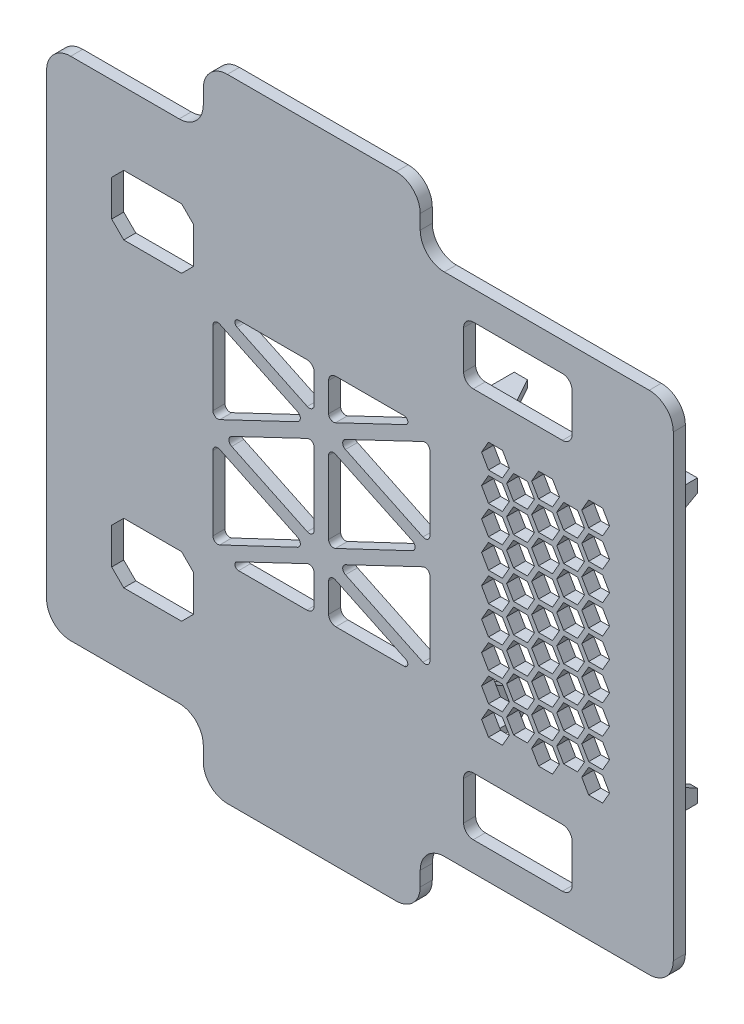
from build123d import *

# Parameters (mm, degrees)
EXTRUDE_1_DEPTH       = 5
EXTRUDE_2_DEPTH       = 20
CUT_EXTRUDE_3_DEPTH   = 10
CUT_EXTRUDE_4_DEPTH   = 10
MIRROR_2_COPY_1_DEPTH = 20
MIRROR_2_COPY_2_DEPTH = 10
MIRROR_2_COPY_3_DEPTH = 10
MIRROR_2_COPY_4_DEPTH = 20
MIRROR_2_COPY_5_DEPTH = 10
MIRROR_2_COPY_6_DEPTH = 10
CUT_EXTRUDE_5_DEPTH   = 5
SKETCH_9_W            = 45
SKETCH_9_H            = 24
CUT_EXTRUDE_6_DEPTH   = 5
FILLET_1_R            = 4
FILLET_2_R            = 1.5
FILLET_3_R            = 2
FILLET_4_R            = 3
CUT_EXTRUDE_8_DEPTH   = 186.636742053


with BuildPart() as part:
    # 草图1 → 凸台-拉伸1 (new body)
    with BuildSketch(Plane.XY):
        with BuildLine():
            Line((-130, 95), (-130, -95))
            ThreePointArc((-130, -95), (-127.071067812, -102.071067812), (-120, -105))
            Line((-120, -105), (-75, -105))
            ThreePointArc((-75, -105), (-67.928932188, -107.928932188), (-65, -115))
            Line((-65, -115), (-65, -121))
            ThreePointArc((-65, -121), (-62.071067812, -128.071067812), (-55, -131))
            Line((-55, -131), (15, -131))
            ThreePointArc((15, -131), (22.071067812, -128.071067812), (25, -121))
            Line((25, -121), (25, -115))
            ThreePointArc((25, -115), (27.928932188, -107.928932188), (35, -105))
            Line((35, -105), (120, -105))
            ThreePointArc((120, -105), (127.071067812, -102.071067812), (130, -95))
            Line((130, -95), (130, 95))
            ThreePointArc((130, 95), (127.071067812, 102.071067812), (120, 105))
            Line((120, 105), (35, 105))
            ThreePointArc((35, 105), (27.928932188, 107.928932188), (25, 115))
            Line((25, 115), (25, 121))
            ThreePointArc((25, 121), (22.071067812, 128.071067812), (15, 131))
            Line((15, 131), (-55, 131))
            ThreePointArc((-55, 131), (-62.071067812, 128.071067812), (-65, 121))
            Line((-65, 121), (-65, 115))
            ThreePointArc((-65, 115), (-67.928932188, 107.928932188), (-75, 105))
            Line((-75, 105), (-120, 105))
            ThreePointArc((-120, 105), (-127.071067812, 102.071067812), (-130, 95))
        make_face()
    extrude(amount=EXTRUDE_1_DEPTH)

    # 草图4 → 凸台-拉伸2 (add)
    with BuildSketch(Plane(origin=(0, 0, 0), x_dir=(-1, 0, 0), z_dir=(0, 0, -1))):
        Polygon((-39, -47.5), (-39, -58.5), (-50, -58.5), (-50, -55.5), (-42, -55.5), (-42, -47.5), align=None)
    extrude_2 = extrude(amount=EXTRUDE_2_DEPTH)

    # 草图5 → 切除-拉伸3 (cut)
    with BuildSketch(Plane.XZ.offset(58.5)):
        Polygon((50, -10), (44.5, -20), (50, -20), align=None)
    cut_extrude_3 = extrude(amount=-CUT_EXTRUDE_3_DEPTH, mode=Mode.SUBTRACT)

    # 草图6 → 切除-拉伸4 (cut)
    with BuildSketch(Plane.ZY.offset(-39)):
        Polygon((-20, -53), (-10, -47.5), (-20, -47.5), align=None)
    cut_extrude_4 = extrude(amount=-CUT_EXTRUDE_4_DEPTH, mode=Mode.SUBTRACT)

    # 镜向1: 凸台-拉伸2, 切除-拉伸3, 切除-拉伸4 across plane
    add(extrude_2.mirror(Plane(origin=(77, 0, 0), x_dir=(0, 0, 1), z_dir=(1, 0, 0))))
    add(cut_extrude_3.mirror(Plane(origin=(77, 0, 0), x_dir=(0, 0, 1), z_dir=(1, 0, 0))), mode=Mode.SUBTRACT)
    add(cut_extrude_4.mirror(Plane(origin=(77, 0, 0), x_dir=(0, 0, 1), z_dir=(1, 0, 0))), mode=Mode.SUBTRACT)

    # 镜向2 copy 1 sketch → 镜向2 copy 1 (add)
    with BuildSketch(Plane(origin=(154, 0, 0), x_dir=(1, 0, 0), z_dir=(0, 0, -1))):
        Polygon((-39, -47.5), (-39, -58.5), (-50, -58.5), (-50, -55.5), (-42, -55.5), (-42, -47.5), align=None)
    extrude(amount=MIRROR_2_COPY_1_DEPTH)

    # 镜向2 copy 2 sketch → 镜向2 copy 2 (cut)
    with BuildSketch(Plane(origin=(154, 58.5, 0), x_dir=(-1, 0, 0), z_dir=(0, 1, 0))):
        Polygon((50, -10), (44.5, -20), (50, -20), align=None)
    extrude(amount=-MIRROR_2_COPY_2_DEPTH, mode=Mode.SUBTRACT)

    # 镜向2 copy 3 sketch → 镜向2 copy 3 (cut)
    with BuildSketch(Plane(origin=(115, 0, 0), x_dir=(0, 0, 1), z_dir=(1, 0, 0))):
        Polygon((-20, -53), (-10, -47.5), (-20, -47.5), align=None)
    extrude(amount=-MIRROR_2_COPY_3_DEPTH, mode=Mode.SUBTRACT)

    # 镜向2 copy 4 sketch → 镜向2 copy 4 (add)
    with BuildSketch(Plane(origin=(0, 0, 0), x_dir=(-1, 0, 0), z_dir=(0, 0, -1))):
        Polygon((-39, 47.5), (-39, 58.5), (-50, 58.5), (-50, 55.5), (-42, 55.5), (-42, 47.5), align=None)
    extrude(amount=MIRROR_2_COPY_4_DEPTH)

    # 镜向2 copy 5 sketch → 镜向2 copy 5 (cut)
    with BuildSketch(Plane(origin=(0, 58.5, 0), x_dir=(1, 0, 0), z_dir=(0, 1, 0))):
        Polygon((50, 10), (44.5, 20), (50, 20), align=None)
    extrude(amount=-MIRROR_2_COPY_5_DEPTH, mode=Mode.SUBTRACT)

    # 镜向2 copy 6 sketch → 镜向2 copy 6 (cut)
    with BuildSketch(Plane.ZY.offset(-39)):
        Polygon((-20, 53), (-10, 47.5), (-20, 47.5), align=None)
    extrude(amount=-MIRROR_2_COPY_6_DEPTH, mode=Mode.SUBTRACT)

    # 草图7 → 切除-拉伸5 (cut)
    with BuildSketch(Plane(origin=(0, 0, 0), x_dir=(-1, 0, 0), z_dir=(0, 0, -1))):
        Polygon((-92.012994616, 36), (-94.899745962, 41), (-100.673248654, 41), (-103.56, 36), (-100.673248654, 31), (-94.899745962, 31), align=None)
        Polygon((-74.115136271, 31), (-71.228384925, 36), (-74.115136271, 41), (-79.888638963, 41), (-82.775390309, 36), (-79.888638963, 31), align=None)
        Polygon((-92.012994616, 24), (-94.899745962, 29), (-100.673248654, 29), (-103.56, 24), (-100.673248654, 19), (-94.899745962, 19), align=None)
        Polygon((-93.167695155, 30), (-90.280943809, 25), (-84.507441117, 25), (-81.620689771, 30), (-84.507441117, 35), (-90.280943809, 35), align=None)
        Polygon((-84.507441117, 37), (-81.620689771, 42), (-84.507441117, 47), (-90.280943809, 47), (-93.167695155, 42), (-90.280943809, 37), align=None)
        Polygon((-79.888638963, 43), (-74.115136271, 43), (-71.228384925, 48), (-74.115136271, 53), (-79.888638963, 53), (-82.775390309, 48), align=None)
        Polygon((-94.899745962, 43), (-92.012994616, 48), (-94.899745962, 53), (-100.673248654, 53), (-103.56, 48), (-100.673248654, 43), align=None)
        Polygon((-72.383085464, 42), (-69.496334118, 37), (-63.722831426, 37), (-60.83608008, 42), (-63.722831426, 47), (-69.496334118, 47), align=None)
        Polygon((-93.167695155, 18), (-90.280943809, 13), (-84.507441117, 13), (-81.620689771, 18), (-84.507441117, 23), (-90.280943809, 23), align=None)
        Polygon((-74.115136271, 19), (-71.228384925, 24), (-74.115136271, 29), (-79.888638963, 29), (-82.775390309, 24), (-79.888638963, 19), align=None)
        Polygon((-72.383085464, 30), (-69.496334118, 25), (-63.722831426, 25), (-60.83608008, 30), (-63.722831426, 35), (-69.496334118, 35), align=None)
        Polygon((-92.012994616, 12), (-94.899745962, 17), (-100.673248654, 17), (-103.56, 12), (-100.673248654, 7), (-94.899745962, 7), align=None)
        Polygon((-93.167695155, 6), (-90.280943809, 1), (-84.507441117, 1), (-81.620689771, 6), (-84.507441117, 11), (-90.280943809, 11), align=None)
        Polygon((-74.115136271, 7), (-71.228384925, 12), (-74.115136271, 17), (-79.888638963, 17), (-82.775390309, 12), (-79.888638963, 7), align=None)
        Polygon((-72.383085464, 18), (-69.496334118, 13), (-63.722831426, 13), (-60.83608008, 18), (-63.722831426, 23), (-69.496334118, 23), align=None)
        Polygon((-92.012994616, 0), (-94.899745962, 5), (-100.673248654, 5), (-103.56, 0), (-100.673248654, -5), (-94.899745962, -5), align=None)
        Polygon((-93.167695155, -6), (-90.280943809, -11), (-84.507441117, -11), (-81.620689771, -6), (-84.507441117, -1), (-90.280943809, -1), align=None)
        Polygon((-74.115136271, -5), (-71.228384925, 0), (-74.115136271, 5), (-79.888638963, 5), (-82.775390309, 0), (-79.888638963, -5), align=None)
        Polygon((-72.383085464, 6), (-69.496334118, 1), (-63.722831426, 1), (-60.83608008, 6), (-63.722831426, 11), (-69.496334118, 11), align=None)
        Polygon((-92.012994616, -12), (-94.899745962, -7), (-100.673248654, -7), (-103.56, -12), (-100.673248654, -17), (-94.899745962, -17), align=None)
        Polygon((-93.167695155, -18), (-90.280943809, -23), (-84.507441117, -23), (-81.620689771, -18), (-84.507441117, -13), (-90.280943809, -13), align=None)
        Polygon((-74.115136271, -17), (-71.228384925, -12), (-74.115136271, -7), (-79.888638963, -7), (-82.775390309, -12), (-79.888638963, -17), align=None)
        Polygon((-72.383085464, -6), (-69.496334118, -11), (-63.722831426, -11), (-60.83608008, -6), (-63.722831426, -1), (-69.496334118, -1), align=None)
        Polygon((-92.012994616, -24), (-94.899745962, -19), (-100.673248654, -19), (-103.56, -24), (-100.673248654, -29), (-94.899745962, -29), align=None)
        Polygon((-93.167695155, -30), (-90.280943809, -35), (-84.507441117, -35), (-81.620689771, -30), (-84.507441117, -25), (-90.280943809, -25), align=None)
        Polygon((-74.115136271, -29), (-71.228384925, -24), (-74.115136271, -19), (-79.888638963, -19), (-82.775390309, -24), (-79.888638963, -29), align=None)
        Polygon((-72.383085464, -18), (-69.496334118, -23), (-63.722831426, -23), (-60.83608008, -18), (-63.722831426, -13), (-69.496334118, -13), align=None)
        Polygon((-92.012994616, -36), (-94.899745962, -31), (-100.673248654, -31), (-103.56, -36), (-100.673248654, -41), (-94.899745962, -41), align=None)
        Polygon((-93.167695155, -42), (-90.280943809, -47), (-84.507441117, -47), (-81.620689771, -42), (-84.507441117, -37), (-90.280943809, -37), align=None)
        Polygon((-74.115136271, -41), (-71.228384925, -36), (-74.115136271, -31), (-79.888638963, -31), (-82.775390309, -36), (-79.888638963, -41), align=None)
        Polygon((-72.383085464, -30), (-69.496334118, -35), (-63.722831426, -35), (-60.83608008, -30), (-63.722831426, -25), (-69.496334118, -25), align=None)
        Polygon((-92.012994616, -48), (-94.899745962, -43), (-100.673248654, -43), (-103.56, -48), (-100.673248654, -53), (-94.899745962, -53), align=None)
        Polygon((-74.115136271, -53), (-71.228384925, -48), (-74.115136271, -43), (-79.888638963, -43), (-82.775390309, -48), (-79.888638963, -53), align=None)
        Polygon((-72.383085464, -42), (-69.496334118, -47), (-63.722831426, -47), (-60.83608008, -42), (-63.722831426, -37), (-69.496334118, -37), align=None)
        Polygon((-61.990780618, 36), (-59.104029272, 31), (-53.330526581, 31), (-50.443775235, 36), (-53.330526581, 41), (-59.104029272, 41), align=None)
        Polygon((-61.990780618, 48), (-59.104029272, 43), (-53.330526581, 43), (-50.443775235, 48), (-53.330526581, 53), (-59.104029272, 53), align=None)
        Polygon((-61.990780618, 24), (-59.104029272, 19), (-53.330526581, 19), (-50.443775235, 24), (-53.330526581, 29), (-59.104029272, 29), align=None)
        Polygon((-61.990780618, 12), (-59.104029272, 7), (-53.330526581, 7), (-50.443775235, 12), (-53.330526581, 17), (-59.104029272, 17), align=None)
        Polygon((-61.990780618, 0), (-59.104029272, -5), (-53.330526581, -5), (-50.443775235, 0), (-53.330526581, 5), (-59.104029272, 5), align=None)
        Polygon((-61.990780618, -12), (-59.104029272, -17), (-53.330526581, -17), (-50.443775235, -12), (-53.330526581, -7), (-59.104029272, -7), align=None)
        Polygon((-61.990780618, -24), (-59.104029272, -29), (-53.330526581, -29), (-50.443775235, -24), (-53.330526581, -19), (-59.104029272, -19), align=None)
        Polygon((-61.990780618, -36), (-59.104029272, -41), (-53.330526581, -41), (-50.443775235, -36), (-53.330526581, -31), (-59.104029272, -31), align=None)
        Polygon((-61.990780618, -48), (-59.104029272, -53), (-53.330526581, -53), (-50.443775235, -48), (-53.330526581, -43), (-59.104029272, -43), align=None)
    extrude(amount=-CUT_EXTRUDE_5_DEPTH, mode=Mode.SUBTRACT)

    # 草图9 → 切除-拉伸6 (cut)
    with BuildSketch(Plane(origin=(0, 0, 0), x_dir=(-1, 0, 0), z_dir=(0, 0, -1))):
        Polygon((9.804878049, 22.5), (-29, 41), (-29, 4), align=None)
        Polygon((13, -26.88372093), (-25, -45), (13, -45), align=None)
        Polygon((22.074593576, -22.557461202), (61, -41), (61, -4), align=None)
        Polygon((19, 26.88372093), (57, 45), (19, 45), align=None)
        Polygon((19, -18.11627907), (57, 0), (19, 18.11627907), align=None)
        with Locations((-65.5, 81)):
            Rectangle(SKETCH_9_W, SKETCH_9_H)
        with Locations((-65.5, -81)):
            Rectangle(SKETCH_9_W, SKETCH_9_H)
        Polygon((13, 45), (-25, 45), (13, 26.88372093), align=None)
        Polygon((61, 4), (61, 41), (22.074593576, 22.557461202), align=None)
        Polygon((13, 18.257993079), (-25.535898385, 0), (13, -18.257993079), align=None)
        Polygon((19, -45), (57, -45), (19, -26.88372093), align=None)
        Polygon((-29, -41), (9.804878049, -22.5), (-29, -4), align=None)
    extrude(amount=-CUT_EXTRUDE_6_DEPTH, mode=Mode.SUBTRACT)

    # 圆角1
    fillet_1_edges = [part.edges().sort_by_distance(p)[0] for p in [
        (43, -93, 2.5),
        (88, -69, 2.5),
        (43, -69, 2.5),
        (88, -93, 2.5),
        (88, 69, 2.5),
        (43, 69, 2.5),
        (43, 93, 2.5),
        (88, 93, 2.5),
    ]]
    fillet(fillet_1_edges, radius=FILLET_1_R)

    # 圆角2
    fillet_2_edges = [part.edges().sort_by_distance(p)[0] for p in [
        (25, -45, 2.5),
        (-57, -45, 2.5),
        (25, 45, 2.5),
        (-57, 45, 2.5),
    ]]
    fillet(fillet_2_edges, radius=FILLET_2_R)

    # 圆角3
    fillet_3_edges = [part.edges().sort_by_distance(p)[0] for p in [
        (29, -4, 2.5),
        (29, 4, 2.5),
        (-13, -18.257993079, 2.5),
        (-61, -41, 2.5),
        (-61, 4, 2.5),
        (-13, -26.88372093, 2.5),
        (-13, 18.257993079, 2.5),
        (-61, -4, 2.5),
        (-22.074593576, -22.557461202, 2.5),
        (25.535898385, 0, 2.5),
        (-22.074593576, 22.557461202, 2.5),
        (-61, 41, 2.5),
        (-19, 26.88372093, 2.5),
        (-19, -26.88372093, 2.5),
        (-19, -18.11627907, 2.5),
        (29, -41, 2.5),
        (29, 41, 2.5),
        (-57, 0, 2.5),
        (-9.804878049, -22.5, 2.5),
        (-13, 26.88372093, 2.5),
        (-9.804878049, 22.5, 2.5),
        (-19, 18.11627907, 2.5),
    ]]
    fillet(fillet_3_edges, radius=FILLET_3_R)

    # 圆角4
    fillet_4_edges = [part.edges().sort_by_distance(p)[0] for p in [
        (-13, -45, 2.5),
        (-13, 45, 2.5),
        (-19, -45, 2.5),
        (-19, 45, 2.5),
    ]]
    fillet(fillet_4_edges, radius=FILLET_4_R)

    # 草图11 → 切除-拉伸8 (cut, through all)
    with BuildSketch(Plane(origin=(0, 0, 0), x_dir=(-1, 0, 0), z_dir=(0, 0, -1))):
        Polygon((74, -75), (98, -75), (103, -70), (103, -55), (98, -50), (74, -50), (69, -55), (69, -70), align=None)
        Polygon((98, 75), (103, 70), (103, 55), (98, 50), (74, 50), (69, 55), (69, 70), (74, 75), align=None)
    extrude(amount=-CUT_EXTRUDE_8_DEPTH, mode=Mode.SUBTRACT)


solid = part.part
